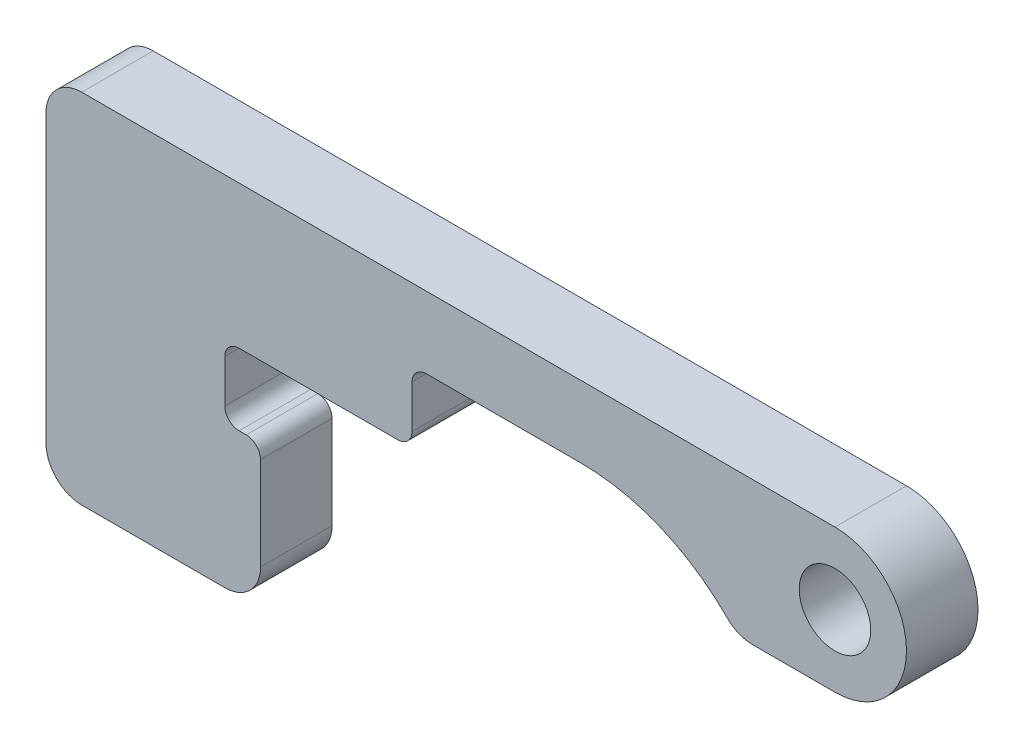
from build123d import *

# Parameters (mm, degrees)
SKETCH1_R           = 5
BOSS_EXTRUDE1_DEPTH = 10
FILLET1_R           = 5
FILLET2_R           = 2


with BuildPart() as part:
    # Sketch1 → Boss-Extrude1 (new body)
    with BuildSketch(Plane.XY):
        with BuildLine():
            Line((-80.316945701, -40), (-110.316945701, -40))
            Line((-110.316945701, -40), (-110.316945701, 10))
            Line((-110.316945701, 10), (0, 10))
            ThreePointArc((0, 10), (10, 0), (0, -10))
            Line((0, -10), (-13.703998561, -10))
            ThreePointArc((-13.703998561, -10), (-23.539034413, -2.618771092), (-35.553713283, 0))
            Line((-35.553713283, 0), (-59.138370651, 0))
            Line((-59.138370651, 0), (-59.138370651, -10))
            Line((-59.138370651, -10), (-85.316945701, -10))
            Line((-85.316945701, -10), (-85.316945701, -20))
            Line((-85.316945701, -20), (-80.316945701, -20))
            Line((-80.316945701, -20), (-80.316945701, -40))
        make_face()
        Circle(SKETCH1_R, mode=Mode.SUBTRACT)
    extrude(amount=BOSS_EXTRUDE1_DEPTH)

    # Fillet1
    fillet1_edges = [part.edges().sort_by_distance(p)[0] for p in [
        (-13.703998561, -10, 5),
        (-110.316945701, 10, 5),
        (-80.316945701, -40, 5),
        (-110.316945701, -40, 5),
    ]]
    fillet(fillet1_edges, radius=FILLET1_R)

    # Fillet2
    fillet2_edges = [part.edges().sort_by_distance(p)[0] for p in [
        (-59.138370651, 0, 5),
        (-59.138370651, -10, 5),
        (-85.316945701, -10, 5),
        (-85.316945701, -20, 5),
        (-80.316945701, -20, 5),
    ]]
    fillet(fillet2_edges, radius=FILLET2_R)


solid = part.part
